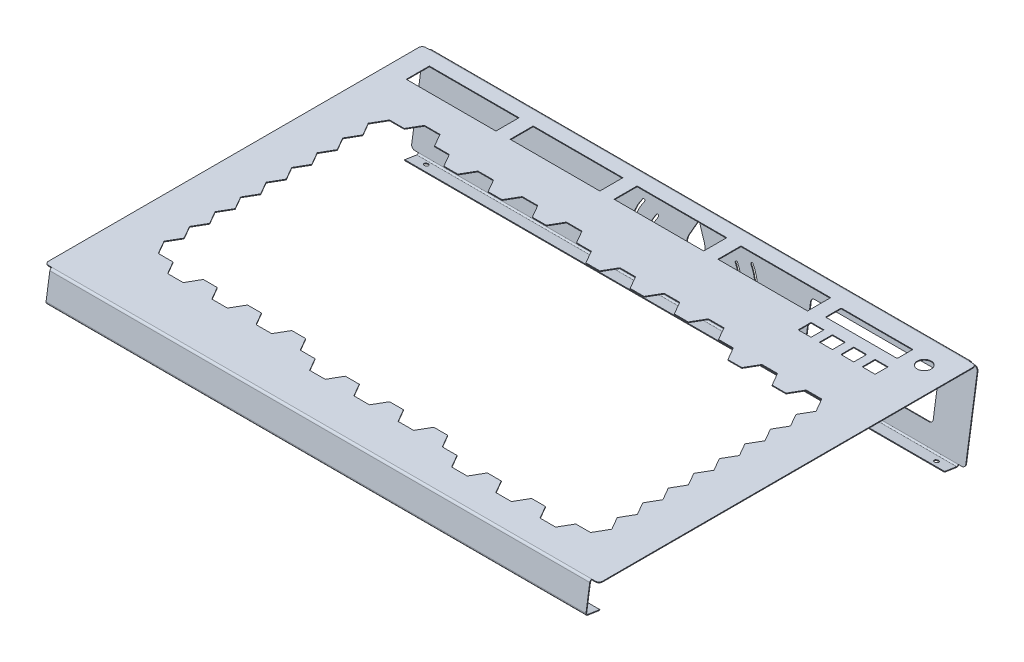
from build123d import *

# Parameters (mm, degrees)
SKETCH1_W                    = 481.838
SKETCH1_H                    = 340.0044
BASE_FLANGE1_DEPTH           = 0.6604
CUT_EXTRUDE1_DEPTH           = 388.714735506
EDGE_FLANGE1_START           = -330.2
EDGE_FLANGE1_DEPTH           = 481.838
EDGE_FLANGE1_2_DEPTH         = 481.838
EDGE_FLANGE2_STRIP_W         = 5.1816
EDGE_FLANGE2_STRIP_H         = 0.6604
EDGE_FLANGE2_STRIP_CUT_DEPTH = 481.838
EDGE_FLANGE2_DEPTH           = 481.838
EDGE_FLANGE3_STRIP_CUT_DEPTH = 481.838
EDGE_FLANGE3_DEPTH           = 481.838
CUT_EXTRUDE2_DEPTH           = 0.6604
EDGE_FLANGE4_STRIP_W         = 5.1816
EDGE_FLANGE4_STRIP_H         = 0.6604
EDGE_FLANGE4_STRIP_CUT_DEPTH = 481.838
EDGE_FLANGE4_DEPTH           = 481.838
SKETCH29_W                   = 6.35
SKETCH29_H                   = 336.766690974
TAB1_DEPTH                   = 0.6604
SKETCH30_W                   = 80.01
SKETCH30_H                   = 20.574
CUT_EXTRUDE6_DEPTH           = 0.6604
LPATTERN1_COUNT              = 4
LPATTERN1_PITCH              = 92.71
SKETCH31_R                   = 6.223
SKETCH31_W                   = 64.008
SKETCH31_H                   = 13.9954
SKETCH31_W_2                 = 11.5062
SKETCH31_H_2                 = 11.5062
CUT_EXTRUDE7_DEPTH           = 0.6604
CUT_EXTRUDE8_DEPTH           = 0.6604
SKETCH34_W                   = 6.35
SKETCH34_H                   = 73.450710069
TAB2_DEPTH                   = 0.6604
SKETCH35_W                   = 6.35
SKETCH35_H                   = 73.450710069
TAB3_DEPTH                   = 0.6604
SKETCH36_W                   = 6.35
SKETCH36_H                   = 336.766690974
TAB4_DEPTH                   = 0.6604
FILLET1_R                    = 3.175
FILLET2_R                    = 0.7874
SKETCH37_R                   = 1.89865
CUT_EXTRUDE9_DEPTH           = 0.6604
SKETCH38_R                   = 1.89865
CUT_EXTRUDE10_DEPTH          = 0.6604
SKETCH39_R                   = 4.7625
CUT_EXTRUDE11_DEPTH          = 0.6604
CUT_EXTRUDE12_DEPTH          = 0.6604


# Read off the part's stored shape, not the designer's step: Edge-Flange1
# Sheet-metal steps are written as plain solids
with BuildPart() as part:
    # Sketch1 → Base-Flange1 (new body)
    with BuildSketch(Plane(origin=(0, 0, 0), x_dir=(1, 0, 0), z_dir=(0, 1, 0))):
        with Locations((-89.281, 33.1978)):
            Rectangle(SKETCH1_W, SKETCH1_H)
    extrude(amount=-BASE_FLANGE1_DEPTH)

    # Sketch4 → Cut-Extrude1 (cut, through all)
    with BuildSketch(Plane(origin=(0, 0, 0), x_dir=(1, 0, 0), z_dir=(0, 1, 0))):
        Polygon((114.842126805, 105.8291), (121.646745743, 94.0435), (115.069436274, 82.6516), (121.646745743, 71.2597), (115.069436274, 59.8678), (121.646745743, 48.4759), (115.069436274, 37.084), (121.646745743, 25.6921), (115.069436274, 14.3002), (121.646745743, 2.9083), (115.069436274, -8.4836), (121.646745743, -19.8755), (115.069436274, -31.2674), (121.646745743, -42.6593), (115.069436274, -54.0512), (121.646745743, -65.4431), (115.069436274, -76.835), (121.646745743, -88.2269), (114.842126805, -100.0125), (101.687446274, -100.0125), (95.110136805, -111.4044), (81.500938938, -111.4044), (74.923629469, -100.0125), (62.223466274, -100.0125), (55.646156805, -111.4044), (42.036958938, -111.4044), (35.459649469, -100.0125), (22.759486274, -100.0125), (16.182176805, -111.4044), (2.572978938, -111.4044), (-4.004330531, -100.0125), (-17.159011062, -100.0125), (-23.736320531, -88.6206), (-36.436483726, -88.6206), (-43.013793195, -100.0125), (-56.622991062, -100.0125), (-63.200300531, -88.6206), (-75.900463726, -88.6206), (-82.477773195, -100.0125), (-96.086971062, -100.0125), (-102.664280531, -88.6206), (-115.364443726, -88.6206), (-121.941753195, -100.0125), (-135.550951062, -100.0125), (-142.128260531, -88.6206), (-155.282941062, -88.6206), (-161.860250531, -77.2287), (-174.560413726, -77.2287), (-181.137723195, -88.6206), (-194.746921062, -88.6206), (-201.324230531, -77.2287), (-214.024393726, -77.2287), (-220.601703195, -88.6206), (-234.210901062, -88.6206), (-240.788210531, -77.2287), (-253.488373726, -77.2287), (-260.065683195, -88.6206), (-273.674881062, -88.6206), (-280.252190531, -77.2287), (-293.397981062, -77.2287), (-300.2026, -65.4431), (-293.625290531, -54.0512), (-300.2026, -42.6593), (-293.625290531, -31.2674), (-300.2026, -19.8755), (-293.625290531, -8.4836), (-300.2026, 2.9083), (-293.625290531, 14.3002), (-300.2026, 25.6921), (-293.625290531, 37.084), (-300.2026, 48.4759), (-293.625290531, 59.8678), (-300.2026, 71.2597), (-293.625290531, 82.6516), (-300.2026, 94.0435), (-293.625290531, 105.4354), (-300.2026, 116.8273), (-293.397981062, 128.6129), (-280.252190531, 128.6129), (-273.674881062, 140.0048), (-260.065683195, 140.0048), (-253.488373726, 128.6129), (-240.333693195, 128.6129), (-233.756383726, 117.221), (-221.056220531, 117.221), (-214.478911062, 128.6129), (-200.869713195, 128.6129), (-194.292403726, 117.221), (-181.592240531, 117.221), (-175.014931062, 128.6129), (-161.405733195, 128.6129), (-154.828423726, 117.221), (-142.128260531, 117.221), (-135.550951062, 128.6129), (-121.941753195, 128.6129), (-115.364443726, 117.221), (-102.209763195, 117.221), (-95.632453726, 105.8291), (-82.932290531, 105.8291), (-76.354981062, 117.221), (-62.745783195, 117.221), (-56.168473726, 105.8291), (-43.468310531, 105.8291), (-36.891001062, 117.221), (-23.281803195, 117.221), (-16.704493726, 105.8291), (-4.004330531, 105.8291), (2.572978938, 117.221), (16.182176805, 117.221), (22.759486274, 105.8291), (35.914166805, 105.8291), (42.491476274, 94.4372), (55.191639469, 94.4372), (61.768948938, 105.8291), (75.378146805, 105.8291), (81.955456274, 94.4372), (94.655619469, 94.4372), (101.232928938, 105.8291), align=None)
    extrude(amount=-CUT_EXTRUDE1_DEPTH, mode=Mode.SUBTRACT)

    # Edge-Flange1 outline → Edge-Flange1 (cut)
    with BuildSketch(Plane.YZ.offset(EDGE_FLANGE1_START)):
        with BuildLine():
            ThreePointArc((0, -201.052611381), (-0.17283746, -201.85099605), (-0.6604, -202.506414724))
            Line((-0.6604, -202.506414724), (-0.6604, -203.2))
            Line((-0.6604, -203.2), (0, -203.2))
            Line((0, -203.2), (0, -201.052611381))
        make_face()
    extrude(amount=EDGE_FLANGE1_DEPTH, mode=Mode.SUBTRACT)

    # Edge-Flange1 2 outline → Edge-Flange1 2 (add)
    with BuildSketch(Plane.YZ.offset(EDGE_FLANGE1_START)):
        with BuildLine():
            Line((-76.082292801, -191.65007176), (-2.222610363, -202.960766842))
            ThreePointArc((-2.222610363, -202.960766842), (-1.391301581, -202.906207091), (-0.6604, -202.506414724))
            Line((-0.6604, -202.506414724), (-0.6604, -201.052611381))
            ThreePointArc((-0.6604, -201.052611381), (-1.103130228, -202.016211258), (-2.12264366, -202.307976816))
            Line((-2.12264366, -202.307976816), (-75.982326098, -190.997281734))
            Line((-75.982326098, -190.997281734), (-76.082292801, -191.65007176))
        make_face()
    extrude(amount=EDGE_FLANGE1_2_DEPTH)

    # Edge-Flange2 strip (across the edge) → Edge-Flange2 strip cut (cut)
    with BuildSketch(Plane(origin=(-330.2, -75.982326098, -190.997281734), x_dir=(0, 0.988476720451994, -0.15137296034784634), z_dir=(1, 0, 0))):
        with Locations((-1.3208, -0.3302)):
            Rectangle(EDGE_FLANGE2_STRIP_W, EDGE_FLANGE2_STRIP_H)
    extrude(amount=EDGE_FLANGE2_STRIP_CUT_DEPTH, mode=Mode.SUBTRACT)

    # Edge-Flange2 section (across the edge) → Edge-Flange2 (add)
    with BuildSketch(Plane(origin=(-330.2, -75.982326098, -190.997281734), x_dir=(0, 0.988476720451994, -0.15137296034784634), z_dir=(1, 0, 0))):
        with BuildLine():
            Line((-0.6604, 1.27), (-0.6604, 12.0396))
            Line((-0.6604, 12.0396), (0, 12.0396))
            Line((0, 12.0396), (0, 1.27))
            ThreePointArc((0, 1.27), (0.371974388, 0.371974388), (1.27, 0))
            Line((1.27, 0), (1.27, -0.6604))
            ThreePointArc((1.27, -0.6604), (-0.09499893, -0.09499893), (-0.6604, 1.27))
        make_face()
    extrude(amount=EDGE_FLANGE2_DEPTH)

    # Edge-Flange3 strip (across the edge) → Edge-Flange3 strip cut (cut)
    with BuildSketch(Plane(origin=(151.638, -0.6604, 136.8044), x_dir=(0, -0.15137296034785702, -0.9884767204519923), z_dir=(-1, 0, 0))):
        Polygon((-4.144101337, -0.033480923), (0.977789637, -0.817835054), (1.07775634, -0.165045028), (-4.044134634, 0.619309104), align=None)
    extrude(amount=EDGE_FLANGE3_STRIP_CUT_DEPTH, mode=Mode.SUBTRACT)

    # Edge-Flange3 section (across the edge) → Edge-Flange3 (add)
    with BuildSketch(Plane(origin=(151.638, -0.6604, 136.8044), x_dir=(0, -0.15137296034785702, -0.9884767204519923), z_dir=(-1, 0, 0))):
        with BuildLine():
            Line((-0.6604, 1.090320407), (-0.6604, 24.833033388))
            Line((-0.6604, 24.833033388), (0, 24.833033388))
            Line((0, 24.833033388), (0, 1.090320407))
            ThreePointArc((0, 1.090320407), (0.306400123, 0.263050635), (1.07775634, -0.165045028))
            Line((1.07775634, -0.165045028), (0.977789637, -0.817835054))
            ThreePointArc((0.977789637, -0.817835054), (-0.194671814, -0.167129647), (-0.6604, 1.090320407))
        make_face()
    extrude(amount=EDGE_FLANGE3_DEPTH)

    # Sketch20 → Cut-Extrude2 (cut)
    with BuildSketch(Plane(origin=(0, 0, 0), x_dir=(1, 0, 0), z_dir=(0, 1, 0))):
        Polygon((-194.145758908, 117.475), (-200.723068378, 128.8669), (-214.625555879, 128.8669), (-221.202865348, 117.475), (-233.609738908, 117.475), (-240.187048378, 128.8669), (-253.341728908, 128.8669), (-259.919038378, 140.2588), (-273.821525879, 140.2588), (-280.398835348, 128.8669), (-293.544625879, 128.8669), (-300.495896088, 116.8273), (-293.918586619, 105.4354), (-300.495896088, 94.0435), (-293.918586619, 82.6516), (-300.495896088, 71.2597), (-293.918586619, 59.8678), (-300.495896088, 48.4759), (-293.918586619, 37.084), (-300.495896088, 25.6921), (-293.918586619, 14.3002), (-300.495896088, 2.9083), (-293.918586619, -8.4836), (-300.495896088, -19.8755), (-293.918586619, -31.2674), (-300.495896088, -42.6593), (-293.918586619, -54.0512), (-300.495896088, -65.4431), (-293.544625879, -77.4827), (-280.398835348, -77.4827), (-273.821525879, -88.8746), (-259.919038378, -88.8746), (-253.341728908, -77.4827), (-240.934855348, -77.4827), (-234.357545879, -88.8746), (-220.455058378, -88.8746), (-213.877748908, -77.4827), (-201.470875348, -77.4827), (-194.893565879, -88.8746), (-180.991078378, -88.8746), (-174.413768908, -77.4827), (-162.006895348, -77.4827), (-155.429585879, -88.8746), (-142.274905348, -88.8746), (-135.697595879, -100.2665), (-121.795108378, -100.2665), (-115.217798908, -88.8746), (-102.810925348, -88.8746), (-96.233615879, -100.2665), (-82.331128378, -100.2665), (-75.753818908, -88.8746), (-63.346945348, -88.8746), (-56.769635879, -100.2665), (-42.867148378, -100.2665), (-36.289838908, -88.8746), (-23.882965348, -88.8746), (-17.305655879, -100.2665), (-4.150975348, -100.2665), (2.426334121, -111.6584), (16.328821622, -111.6584), (22.906131092, -100.2665), (35.313004652, -100.2665), (41.890314121, -111.6584), (55.792801622, -111.6584), (62.370111092, -100.2665), (74.776984652, -100.2665), (81.354294121, -111.6584), (95.256781622, -111.6584), (101.834091092, -100.2665), (114.988771622, -100.2665), (121.940041831, -88.2269), (115.362732362, -76.835), (121.940041831, -65.4431), (115.362732362, -54.0512), (121.940041831, -42.6593), (115.362732362, -31.2674), (121.940041831, -19.8755), (115.362732362, -8.4836), (121.940041831, 2.9083), (115.362732362, 14.3002), (121.940041831, 25.6921), (115.362732362, 37.084), (121.940041831, 48.4759), (115.362732362, 59.8678), (121.940041831, 71.2597), (115.362732362, 82.6516), (121.940041831, 94.0435), (114.988771622, 106.0831), (101.086284121, 106.0831), (94.508974652, 94.6912), (82.102101092, 94.6912), (75.524791622, 106.0831), (61.622304121, 106.0831), (55.044994652, 94.6912), (42.638121092, 94.6912), (36.060811622, 106.0831), (22.906131092, 106.0831), (16.328821622, 117.475), (2.426334121, 117.475), (-4.150975348, 106.0831), (-16.557848908, 106.0831), (-23.135158378, 117.475), (-37.037645879, 117.475), (-43.614955348, 106.0831), (-56.021828908, 106.0831), (-62.599138378, 117.475), (-76.501625879, 117.475), (-83.078935348, 106.0831), (-95.485808908, 106.0831), (-102.063118378, 117.475), (-115.217798908, 117.475), (-121.795108378, 128.8669), (-135.697595879, 128.8669), (-142.274905348, 117.475), (-154.681778908, 117.475), (-161.259088378, 128.8669), (-175.161575879, 128.8669), (-181.738885348, 117.475), align=None)
    extrude(amount=-CUT_EXTRUDE2_DEPTH, mode=Mode.SUBTRACT)

    # Edge-Flange4 strip (across the edge) → Edge-Flange4 strip cut (cut)
    with BuildSketch(Plane(origin=(151.638, -25.207275402, 140.563449778), x_dir=(0, 0.9884767204519918, -0.15137296034786094), z_dir=(-1, 0, 0))):
        with Locations((-1.3208, -0.3302)):
            Rectangle(EDGE_FLANGE4_STRIP_W, EDGE_FLANGE4_STRIP_H)
    extrude(amount=EDGE_FLANGE4_STRIP_CUT_DEPTH, mode=Mode.SUBTRACT)

    # Edge-Flange4 section (across the edge) → Edge-Flange4 (add)
    with BuildSketch(Plane(origin=(151.638, -25.207275402, 140.563449778), x_dir=(0, 0.9884767204519918, -0.15137296034786094), z_dir=(-1, 0, 0))):
        with BuildLine():
            Line((-0.6604, 1.27), (-0.6604, 12.0396))
            Line((-0.6604, 12.0396), (0, 12.0396))
            Line((0, 12.0396), (0, 1.27))
            ThreePointArc((0, 1.27), (0.371974388, 0.371974388), (1.27, 0))
            Line((1.27, 0), (1.27, -0.6604))
            ThreePointArc((1.27, -0.6604), (-0.09499893, -0.09499893), (-0.6604, 1.27))
        make_face()
    extrude(amount=EDGE_FLANGE4_DEPTH)

    # Sketch29 → Tab1 (add)
    with BuildSketch(Plane(origin=(0, 0, 0), x_dir=(1, 0, 0), z_dir=(0, 1, 0))):
        with Locations((154.813, 32.669265894)):
            Rectangle(SKETCH29_W, SKETCH29_H)
    extrude(amount=-TAB1_DEPTH)

    # Sketch30 → Cut-Extrude6 (cut)
    with BuildSketch(Plane(origin=(0, 0, 0), x_dir=(1, 0, 0), z_dir=(0, 1, 0))):
        with Locations((-277.495, 178.065611381)):
            Rectangle(SKETCH30_W, SKETCH30_H)
    cut_extrude6 = extrude(amount=-CUT_EXTRUDE6_DEPTH, mode=Mode.SUBTRACT)

    # LPattern1: Cut-Extrude6 ×4
    with Locations(*[(i * LPATTERN1_PITCH, 0, 0) for i in range(1, LPATTERN1_COUNT)]):
        add(cut_extrude6, mode=Mode.SUBTRACT)

    # Sketch31 → Cut-Extrude7 (cut)
    with BuildSketch(Plane(origin=(0, 0, 0), x_dir=(1, 0, 0), z_dir=(0, 1, 0))):
        with Locations(Location((134.493, 178.055891055, 0), (0, 0, 270))):
            Circle(SKETCH31_R)
        with Locations((85.344, 178.065611381)):
            Rectangle(SKETCH31_W, SKETCH31_H)
        with Locations((75.8237721, 154.748411381)):
            Rectangle(SKETCH31_W_2, SKETCH31_H_2)
        with Locations((56.769, 154.748411381)):
            Rectangle(SKETCH31_W_2, SKETCH31_H_2)
        with Locations((94.8785442, 154.748411381)):
            Rectangle(SKETCH31_W_2, SKETCH31_H_2)
        with Locations((113.9333163, 154.748411381)):
            Rectangle(SKETCH31_W_2, SKETCH31_H_2)
    extrude(amount=-CUT_EXTRUDE7_DEPTH, mode=Mode.SUBTRACT)

    # Sketch32 → Cut-Extrude8 (cut)
    with BuildSketch(Plane(origin=(0, -30.419673409, -198.64273606), x_dir=(-1, 0, 0), z_dir=(0, -0.15137296034784972, -0.9884767204519934))):
        with BuildLine():
            Line((-123.063, 10.642185543), (-15.113, 10.642185543))
            ThreePointArc((-15.113, 10.642185543), (-12.86793597, 9.712249573), (-11.938, 7.467185543))
            Line((-11.938, 7.467185543), (-11.938, -24.282814457))
            ThreePointArc((-11.938, -24.282814457), (-12.86793597, -26.527878488), (-15.113, -27.457814457))
            Line((-15.113, -27.457814457), (-123.063, -27.457814457))
            ThreePointArc((-123.063, -27.457814457), (-125.30806403, -26.527878488), (-126.238, -24.282814457))
            Line((-126.238, -24.282814457), (-126.238, 7.467185543))
            ThreePointArc((-126.238, 7.467185543), (-125.30806403, 9.712249573), (-123.063, 10.642185543))
        make_face()
    extrude(amount=-CUT_EXTRUDE8_DEPTH, mode=Mode.SUBTRACT)

    # Sketch34 → Tab2 (add)
    with BuildSketch(Plane(origin=(0, -30.419673409, -198.64273606), x_dir=(-1, 0, 0), z_dir=(0, -0.15137296034784972, -0.9884767204519934))):
        with Locations((-154.813, -8.199581526)):
            Rectangle(SKETCH34_W, SKETCH34_H)
    extrude(amount=-TAB2_DEPTH)

    # Sketch35 → Tab3 (add)
    with BuildSketch(Plane(origin=(0, -30.419673409, -198.64273606), x_dir=(-1, 0, 0), z_dir=(0, -0.15137296034784972, -0.9884767204519934))):
        with Locations((333.375, -8.199581526)):
            Rectangle(SKETCH35_W, SKETCH35_H)
    extrude(amount=-TAB3_DEPTH)

    # Sketch36 → Tab4 (add)
    with BuildSketch(Plane(origin=(0, 0, 0), x_dir=(1, 0, 0), z_dir=(0, 1, 0))):
        with Locations((-333.375, 32.669265894)):
            Rectangle(SKETCH36_W, SKETCH36_H)
    extrude(amount=-TAB4_DEPTH)

    # Fillet1
    fillet1_edges = [part.edges().sort_by_distance(p)[0] for p in [
        (157.988, -0.3302, -201.052611381),
        (157.988, -0.3302, 135.714079593),
        (157.988, -2.172627011, -202.634371829),
        (157.988, -74.776944015, -191.515920406),
        (-336.55, -2.172627011, -202.634371829),
        (-336.55, -74.776944015, -191.515920406),
        (-336.55, -0.3302, -201.052611381),
        (-336.55, -0.3302, 135.714079593),
    ]]
    fillet(fillet1_edges, radius=FILLET1_R)

    # Fillet2
    fillet2_edges = [part.edges().sort_by_distance(p)[0] for p in [
        (53.34, -0.3302, -171.067911381),
        (53.34, -0.3302, -185.063311381),
        (117.348, -0.3302, -185.063311381),
        (117.348, -0.3302, -171.067911381),
    ]]
    fillet(fillet2_edges, radius=FILLET2_R)

    # Sketch37 → Cut-Extrude9 (cut)
    with BuildSketch(Plane(origin=(0, -46.314790505, 7.092536224), x_dir=(1, 0, 0), z_dir=(0, -0.9884767204519918, 0.15137296034786102))):
        with Locations(Location((139.319, 128.168397952, 0), (0, 0, 270))):
            Circle(SKETCH37_R)
        with Locations(Location((-13.081, 129.050688068, 0), (0, 0, 270))):
            Circle(SKETCH37_R)
        with Locations(Location((-165.481, 129.932978183, 0), (0, 0, 270))):
            Circle(SKETCH37_R)
        with Locations(Location((-317.881, 130.815268299, 0), (0, 0, 270))):
            Circle(SKETCH37_R)
    extrude(amount=-CUT_EXTRUDE9_DEPTH, mode=Mode.SUBTRACT)

    # Sketch38 → Cut-Extrude10 (cut)
    with BuildSketch(Plane(origin=(0, -46.315409418, 7.092631003), x_dir=(1, 0, 0), z_dir=(0, -0.9884767204519939, 0.1513729603478471))):
        with Locations(Location((139.319, -193.338436299, 0), (0, 0, 270))):
            Circle(SKETCH38_R)
        with Locations(Location((-13.081, -193.969655828, 0), (0, 0, 270))):
            Circle(SKETCH38_R)
        with Locations(Location((-165.481, -194.600875358, 0), (0, 0, 270))):
            Circle(SKETCH38_R)
        with Locations(Location((-317.881, -195.232094888, 0), (0, 0, 270))):
            Circle(SKETCH38_R)
    extrude(amount=-CUT_EXTRUDE10_DEPTH, mode=Mode.SUBTRACT)

    # Sketch39 → Cut-Extrude11 (cut)
    with BuildSketch(Plane(origin=(0, -30.419673409, -198.64273606), x_dir=(-1, 0, 0), z_dir=(0, -0.15137296034784972, -0.9884767204519934))):
        with Locations(Location((304.8, -10.63493656, 0), (0, 0, 90))):
            Circle(SKETCH39_R)
        with Locations(Location((260.35, -15.241566395, 0), (0, 0, 90))):
            Circle(SKETCH39_R)
        with Locations(Location((215.9, -19.848196231, 0), (0, 0, 90))):
            Circle(SKETCH39_R)
        with Locations(Location((171.45, -24.454826067, 0), (0, 0, 90))):
            Circle(SKETCH39_R)
    extrude(amount=-CUT_EXTRUDE11_DEPTH, mode=Mode.SUBTRACT)

    # Sketch40 → Cut-Extrude12 (cut)
    with BuildSketch(Plane(origin=(0, -30.419673409, -198.64273606), x_dir=(-1, 0, 0), z_dir=(0, -0.15137296034784972, -0.9884767204519934))):
        with BuildLine():
            Line((81.548841842, -18.995804072), (82.907028371, -18.995804072))
            add(Edge.make_bspline(
                [(82.907028371, -18.995804072), (82.212290018, -16.919788278), (80.533395781, -14.894918186), (78.122800006, -13.627444365)],
                knots=[0, 0, 0, 0, 1, 1, 1, 1], degree=3))
            add(Edge.make_bspline(
                [(78.122800006, -13.627444365), (70.71065095, -9.730426621), (67.501562844, -16.607396179), (69.564631552, -20.427883732)],
                knots=[0, 0, 0, 0, 1, 1, 1, 1], degree=3))
            add(Edge.make_bspline(
                [(69.564631552, -20.427883732), (56.880170562, -17.295192856), (61.283598345, -4.328665978), (69.487863138, -3.388520219)],
                knots=[0, 0, 0, 0, 1, 1, 1, 1], degree=3))
            add(Edge.make_bspline(
                [(69.487863138, -3.388520219), (76.8232327, -2.547973401), (84.540422213, -7.667524115), (85.992218895, -17.90630976)],
                knots=[0, 0, 0, 0, 1, 1, 1, 1], degree=3))
            add(Edge.make_bspline(
                [(85.992218895, -17.90630976), (86.042877073, -18.263199505), (86.085408004, -18.627656953), (86.119180123, -18.995804072)],
                knots=[0, 0, 0, 0, 1, 1, 1, 1], degree=3))
            Line((86.119180123, -18.995804072), (87.389180123, -18.995804072))
            add(Edge.make_bspline(
                [(87.389180123, -18.995804072), (86.764645229, -12.051384457), (83.889871183, -7.232536345), (82.168778418, -4.027625433)],
                knots=[0, 0, 0, 0, 1, 1, 1, 1], degree=3))
            add(Edge.make_bspline(
                [(82.168778418, -4.027625433), (79.937735524, 0.126516912), (81.74856595, 4.218898829), (82.630236526, 6.050100002)],
                knots=[0, 0, 0, 0, 1, 1, 1, 1], degree=3))
            add(Edge.make_bspline(
                [(82.630236526, 6.050100002), (83.630403141, 8.127179485), (88.161484658, 16.522769758), (89.315376462, 19.369073509)],
                knots=[0, 0, 0, 0, 1, 1, 1, 1], degree=3))
            add(Edge.make_bspline(
                [(89.315376462, 19.369073509), (90.469212865, 16.522769758), (94.966405922, 8.127179485), (95.966611317, 6.050100002)],
                knots=[0, 0, 0, 0, 1, 1, 1, 1], degree=3))
            add(Edge.make_bspline(
                [(95.966611317, 6.050100002), (96.848531196, 4.218898829), (98.659250821, 0.126516912), (96.428207927, -4.027625433)],
                knots=[0, 0, 0, 0, 1, 1, 1, 1], degree=3))
            add(Edge.make_bspline(
                [(96.428207927, -4.027625433), (94.718666157, -7.210697485), (91.829072488, -12.082790976), (91.158366852, -18.995804072)],
                knots=[0, 0, 0, 0, 1, 1, 1, 1], degree=3))
            Line((91.158366852, -18.995804072), (92.428366852, -18.995804072))
            add(Edge.make_bspline(
                [(92.428366852, -18.995804072), (92.461823188, -18.627501832), (92.504664361, -18.263199505), (92.55532254, -17.90630976)],
                knots=[0, 0, 0, 0, 1, 1, 1, 1], degree=3))
            add(Edge.make_bspline(
                [(92.55532254, -17.90630976), (94.007257723, -7.667352374), (101.724452776, -2.547973401), (109.059805718, -3.388520219)],
                knots=[0, 0, 0, 0, 1, 1, 1, 1], degree=3))
            add(Edge.make_bspline(
                [(109.059805718, -3.388520219), (117.264020651, -4.328494237), (121.667293313, -17.295037735), (108.983347547, -20.427883732)],
                knots=[0, 0, 0, 0, 1, 1, 1, 1], degree=3))
            add(Edge.make_bspline(
                [(108.983347547, -20.427883732), (111.046388554, -16.607396179), (107.837350308, -9.730426621), (100.425151392, -13.627444365)],
                knots=[0, 0, 0, 0, 1, 1, 1, 1], degree=3))
            add(Edge.make_bspline(
                [(100.425151392, -13.627444365), (98.014599937, -14.894918186), (96.335533959, -16.919788278), (95.640967346, -18.995804072)],
                knots=[0, 0, 0, 0, 1, 1, 1, 1], degree=3))
            Line((95.640967346, -18.995804072), (96.882768596, -18.995804072))
            add(Edge.make_bspline(
                [(96.882768596, -18.995804072), (98.054161404, -18.995804072), (99.003841582, -19.683894371), (99.003841582, -20.532906378)],
                knots=[0, 0, 0, 0, 1, 1, 1, 1], degree=3))
            add(Edge.make_bspline(
                [(99.003841582, -20.532906378), (99.003841582, -21.381885145), (98.054161404, -22.069992065), (96.882768596, -22.069992063)],
                knots=[0, 0, 0, 0, 1, 1, 1, 1], degree=3))
            Line((96.882768596, -22.069992063), (95.371216981, -22.069992063))
            add(Edge.make_bspline(
                [(95.371216981, -22.069992063), (95.4947323, -22.73946227), (95.749352801, -23.37320472), (96.146313697, -23.94261062)],
                knots=[0, 0, 0, 0, 1, 1, 1, 1], degree=3))
            add(Edge.make_bspline(
                [(96.146313697, -23.94261062), (97.904031705, -26.464195672), (103.790806731, -25.08876298), (100.505216133, -19.587347994)],
                knots=[0, 0, 0, 0, 1, 1, 1, 1], degree=3))
            add(Edge.make_bspline(
                [(100.505216133, -19.587347994), (106.058181244, -18.856466382), (107.533849984, -24.095471562), (105.929314241, -26.922717556)],
                knots=[0, 0, 0, 0, 1, 1, 1, 1], degree=3))
            add(Edge.make_bspline(
                [(105.929314241, -26.922717556), (104.165895526, -30.527309526), (96.463320654, -31.607723703), (93.548486537, -26.464195672)],
                knots=[0, 0, 0, 0, 1, 1, 1, 1], degree=3))
            add(Edge.make_bspline(
                [(93.548486537, -26.464195672), (92.849471267, -25.23056045), (92.498564771, -23.685452778), (92.385226517, -22.069992063)],
                knots=[0, 0, 0, 0, 1, 1, 1, 1], degree=3))
            Line((92.385226517, -22.069992063), (91.014242563, -22.069992063))
            add(Edge.make_bspline(
                [(91.014242563, -22.069992063), (91.022059568, -23.291306225), (91.095858517, -24.568015302), (91.259057184, -25.901875491)],
                knots=[0, 0, 0, 0, 1, 1, 1, 1], degree=3))
            add(Edge.make_bspline(
                [(91.259057184, -25.901875491), (93.206333395, -27.156119682), (92.447275111, -29.862797662), (94.913576046, -31.480873276)],
                knots=[0, 0, 0, 0, 1, 1, 1, 1], degree=3))
            add(Edge.make_bspline(
                [(94.913576046, -31.480873276), (93.364341039, -31.521681253), (92.100340827, -31.217903926), (91.692482661, -30.647107475)],
                knots=[0, 0, 0, 0, 1, 1, 1, 1], degree=3))
            add(Edge.make_bspline(
                [(91.692482661, -30.647107475), (91.692482661, -32.302301396), (90.21174478, -33.697606232), (89.246491533, -35.706310471)],
                knots=[0, 0, 0, 0, 1, 1, 1, 1], degree=3))
            add(Edge.make_bspline(
                [(89.246491533, -35.706310471), (88.349779732, -33.686348859), (86.904908107, -31.996507492), (86.904908107, -30.647107475)],
                knots=[0, 0, 0, 0, 1, 1, 1, 1], degree=3))
            add(Edge.make_bspline(
                [(86.904908107, -30.647107475), (86.497188442, -31.217903926), (85.23325471, -31.521681253), (83.683831342, -31.480873276)],
                knots=[0, 0, 0, 0, 1, 1, 1, 1], degree=3))
            add(Edge.make_bspline(
                [(83.683831342, -31.480873276), (85.945189366, -30.093573806), (85.05386803, -27.552127691), (87.265349022, -25.736815368)],
                knots=[0, 0, 0, 0, 1, 1, 1, 1], degree=3))
            add(Edge.make_bspline(
                [(87.265349022, -25.736815368), (87.421700192, -24.45994563), (87.497548958, -23.239412616), (87.510025142, -22.069992063)],
                knots=[0, 0, 0, 0, 1, 1, 1, 1], degree=3))
            Line((87.510025142, -22.069992063), (86.162719343, -22.069992063))
            add(Edge.make_bspline(
                [(86.162719343, -22.069992063), (86.049364467, -23.685452778), (85.69835271, -25.23056045), (84.999492562, -26.464195672)],
                knots=[0, 0, 0, 0, 1, 1, 1, 1], degree=3))
            add(Edge.make_bspline(
                [(84.999492562, -26.464195672), (82.084658445, -31.607596282), (74.382083572, -30.527309526), (72.618648238, -26.922717556)],
                knots=[0, 0, 0, 0, 1, 1, 1, 1], degree=3))
            add(Edge.make_bspline(
                [(72.618648238, -26.922717556), (71.013957374, -24.095643303), (72.489659353, -18.856466382), (78.042746345, -19.587347994)],
                knots=[0, 0, 0, 0, 1, 1, 1, 1], degree=3))
            add(Edge.make_bspline(
                [(78.042746345, -19.587347994), (74.757000626, -25.08876298), (80.643936314, -26.464195672), (82.401698641, -23.94261062)],
                knots=[0, 0, 0, 0, 1, 1, 1, 1], degree=3))
            add(Edge.make_bspline(
                [(82.401698641, -23.94261062), (82.798471176, -23.37320472), (83.052980877, -22.73946227), (83.176612536, -22.069992063)],
                knots=[0, 0, 0, 0, 1, 1, 1, 1], degree=3))
            Line((83.176612536, -22.069992063), (81.548841842, -22.069992063))
            add(Edge.make_bspline(
                [(81.548841842, -22.069992063), (80.377415794, -22.069992065), (79.427718996, -21.381741104), (79.427718996, -20.532906378)],
                knots=[0, 0, 0, 0, 1, 1, 1, 1], degree=3))
            add(Edge.make_bspline(
                [(79.427718996, -20.532906378), (79.427718996, -19.68373925), (80.377415794, -18.995804072), (81.548841842, -18.995804072)],
                knots=[0, 0, 0, 0, 1, 1, 1, 1], degree=3))
        make_face()
        with BuildLine():
            ThreePointArc((53.32515243, -29.058296969), (54.875374641, -29.286725577), (55.103803248, -27.736503367))
            add(Edge.make_bspline(
                [(49.665767325, -11.807637049), (49.772827635, -17.417131577), (51.757285621, -23.233314437), (55.103803248, -27.736503367)],
                knots=[0, 0, 0, 0, 0.989781357, 0.989781357, 0.989781357, 0.989781357], degree=3))
            add(Edge.make_bspline(
                [(54.878701227, 4.675025511), (51.506581459, 0.002266162), (49.593820503, -6.045632597), (49.665767325, -11.807637049)],
                knots=[0, 0, 0, 0, 1, 1, 1, 1], degree=3))
            ThreePointArc((54.878701227, 4.675025511), (54.156383777, 6.065574335), (52.765834953, 5.343256884))
            add(Edge.make_bspline(
                [(47.444914173, -11.480847039), (47.371477184, -5.59948161), (49.323860927, 0.573700604), (52.765834953, 5.343256884)],
                knots=[0, 0, 0, 0, 1, 1, 1, 1], degree=3))
            add(Edge.make_bspline(
                [(53.32515243, -29.058296969), (49.639959737, -24.099375252), (47.522045807, -17.658678413), (47.444914173, -11.480847039)],
                knots=[0, 0, 0, 0, 1.009909674, 1.009909674, 1.009909674, 1.009909674], degree=3))
        make_face()
        with BuildLine():
            ThreePointArc((40.295163736, -34.224632569), (41.845385742, -34.453062569), (42.073815741, -32.902840563))
            add(Edge.make_bspline(
                [(34.910520595, -11.867889214), (35.040189598, -19.27382264), (37.655709631, -26.957674262), (42.073815741, -32.902840563)],
                knots=[0, 0, 0, 0, 0.992225282, 0.992225282, 0.992225282, 0.992225282], degree=3))
            add(Edge.make_bspline(
                [(41.776327199, 9.840948194), (37.335002649, 3.686594285), (34.815768369, -4.278919733), (34.910520595, -11.867889214)],
                knots=[0, 0, 0, 0, 1, 1, 1, 1], degree=3))
            ThreePointArc((41.776327199, 9.840948194), (41.054009886, 11.231497089), (39.663460991, 10.509179776))
            add(Edge.make_bspline(
                [(32.6898, -11.540679959), (32.593559277, -3.832495986), (35.152368077, 4.258147608), (39.663460991, 10.509179776)],
                knots=[0, 0, 0, 0, 1, 1, 1, 1], degree=3))
            add(Edge.make_bspline(
                [(40.295163736, -34.224632569), (35.538312428, -27.823638252), (32.789368831, -19.515041919), (32.6898, -11.540679959)],
                knots=[0, 0, 0, 0, 1.007594664, 1.007594664, 1.007594664, 1.007594664], degree=3))
        make_face()
        with BuildLine():
            ThreePointArc((136.485301257, -32.902840563), (136.713731257, -34.453062569), (138.263953262, -34.224632569))
            add(Edge.make_bspline(
                [(145.869316999, -11.540679959), (145.769748168, -19.515041919), (143.020804572, -27.823638252), (138.263953262, -34.224632569)],
                knots=[0, 0, 0, 0, 1.007594664, 1.007594664, 1.007594664, 1.007594664], degree=3))
            add(Edge.make_bspline(
                [(138.584628012, 11.492612109), (143.296917427, 4.962781471), (145.969850096, -3.488707979), (145.869316999, -11.540679959)],
                knots=[0, 0, 0, 0, 1, 1, 1, 1], degree=3))
            ThreePointArc((138.584628012, 11.492612109), (137.194079117, 12.214929422), (136.471761804, 10.824380527))
            add(Edge.make_bspline(
                [(143.648596405, -11.867889214), (143.747641002, -3.935131726), (141.114282856, 4.39122815), (136.471761804, 10.824380527)],
                knots=[0, 0, 0, 0, 1, 1, 1, 1], degree=3))
            add(Edge.make_bspline(
                [(136.485301257, -32.902840563), (140.903407368, -26.957674262), (143.518927401, -19.27382264), (143.648596405, -11.867889214)],
                knots=[0, 0, 0, 0, 0.992225282, 0.992225282, 0.992225282, 0.992225282], degree=3))
        make_face()
        with BuildLine():
            ThreePointArc((123.455314241, -27.736502707), (123.683741698, -29.286725087), (125.233964078, -29.058297629))
            add(Edge.make_bspline(
                [(131.114202826, -11.480847039), (131.037071189, -17.658678674), (128.919160607, -24.099378438), (125.233964078, -29.058297629)],
                knots=[0, 0, 0, 0, 1.009909674, 1.009909674, 1.009909674, 1.009909674], degree=3))
            add(Edge.make_bspline(
                [(125.482386421, 6.326271009), (129.125471254, 1.278034735), (131.191930658, -5.255839813), (131.114202826, -11.480847039)],
                knots=[0, 0, 0, 0, 1, 1, 1, 1], degree=3))
            ThreePointArc((125.482386421, 6.326271009), (124.091837598, 7.04858846), (123.369520147, 5.658039636))
            add(Edge.make_bspline(
                [(128.893349676, -11.807637054), (128.969587355, -5.701990803), (126.942750712, 0.706600284), (123.369520147, 5.658039636)],
                knots=[0, 0, 0, 0, 1, 1, 1, 1], degree=3))
            add(Edge.make_bspline(
                [(123.455314241, -27.736502707), (126.801835054, -23.233316472), (128.786289479, -17.417131321), (128.893349676, -11.807637054)],
                knots=[0, 0, 0, 0, 0.989781358, 0.989781358, 0.989781358, 0.989781358], degree=3))
        make_face()
    extrude(amount=-CUT_EXTRUDE12_DEPTH, mode=Mode.SUBTRACT)


solid = part.part
